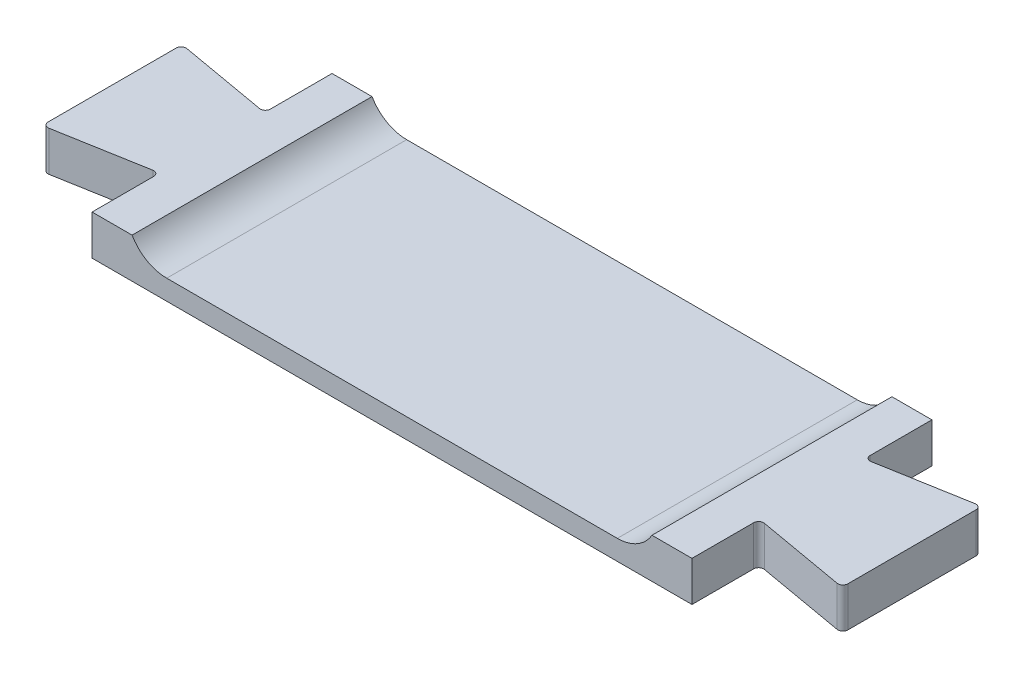
from build123d import *

# Parameters (mm, degrees)
BOSS_EXTRUDE1_DEPTH = 2
FILLET1_R           = 0.25
SKETCH3_W           = 26
SKETCH3_H           = 12
CUT_EXTRUDE2_DEPTH  = 1
FILLET6_R           = 2


with BuildPart() as part:
    # Sketch1 → Boss-Extrude1 (new body)
    with BuildSketch(Plane(origin=(0, 0, 0), x_dir=(1, 0, 0), z_dir=(0, 1, 0))):
        Polygon((-15, 2.618365096), (-20, 3.5), (-20, -3.5), (-15, -2.618365096), (-15, -6), (15, -6), (15, -2.618365096), (20, -3.5), (20, 3.5), (15, 2.618365096), (15, 6), (-15, 6), align=None)
    extrude(amount=BOSS_EXTRUDE1_DEPTH)

    # Fillet1
    fillet1_edges = [part.edges().sort_by_distance(p)[0] for p in [
        (15, 1, -2.618365096),
        (20, 1, -3.5),
        (20, 1, 3.5),
        (15, 1, 2.618365096),
        (-15, 1, 2.618365096),
        (-20, 1, 3.5),
        (-20, 1, -3.5),
        (-15, 1, -2.618365096),
    ]]
    fillet(fillet1_edges, radius=FILLET1_R)

    # Sketch3 → Cut-Extrude2 (cut)
    with BuildSketch(Plane(origin=(0, 2, 0), x_dir=(1, 0, 0), z_dir=(0, 1, 0))):
        Rectangle(SKETCH3_W, SKETCH3_H)
    extrude(amount=-CUT_EXTRUDE2_DEPTH, mode=Mode.SUBTRACT)

    # Fillet6
    # the kernel refuses this fillet: 2 mm, written as the material it adds along each edge
    with BuildSketch(Plane(origin=(-13, 1, 6), x_dir=(0, 1, 0), z_dir=(0, 0, -1))) as fillet6_piece_1:
        with BuildLine():
            CenterArc((2, 1.732050808), FILLET6_R, 180, 60)
            Line((0, 1.732050808), (-0.04, 1.732050808))
            Line((-0.04, 1.732050808), (-0.04, 0))
            Line((-0.04, 0), (0, -0.04))
            ThreePointArc((0, -0.04), (0.5, -0.04), (0.98, -0.034641016))
            Line((0.98, -0.034641016), (1, 0))
        make_face()
    extrude(amount=12)
    with BuildSketch(Plane(origin=(13, 1, -6), x_dir=(-1, 0, 0), z_dir=(0, 0, 1))) as fillet6_piece_2:
        with BuildLine():
            CenterArc((1.732050808, -2), FILLET6_R, 90, 60)
            Line((0, -1), (-0.034641016, -0.98))
            ThreePointArc((-0.034641016, -0.98), (-0.04, -0.5), (-0.04, 0))
            Line((-0.04, 0), (0, 0.04))
            Line((0, 0.04), (1.732050808, 0.04))
            Line((1.732050808, 0.04), (1.732050808, 0))
        make_face()
    extrude(amount=12)


solid = part.part
